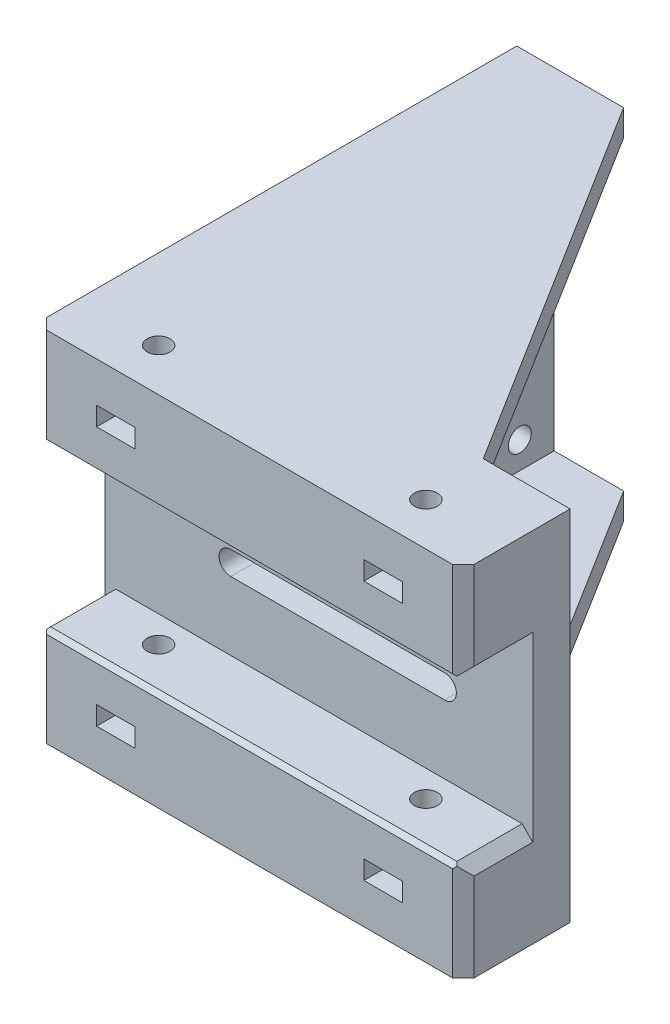
from build123d import *

# Parameters (mm, degrees)
BOSS_EXTRUDE1_DEPTH = 67
SKETCH2_R           = 2.15
SKETCH2_R_2         = 19.1
CUT_EXTRUDE1_DEPTH  = 67
SKETCH3_W           = 70
SKETCH3_H           = 4.9
BOSS_EXTRUDE2_DEPTH = 63
SKETCH4_W           = 20
SKETCH4_H           = 67
BOSS_EXTRUDE3_DEPTH = 10
CHAMFER1_SIZE       = 80
CHAMFER1_SIZE_2     = 50
SKETCH6_W           = 80
SKETCH6_H           = 30
CUT_EXTRUDE2_DEPTH  = 13
SKETCH7_R           = 2.15
CUT_EXTRUDE3_DEPTH  = 100
CUT_EXTRUDE4_DEPTH  = 100
FILLET2_R           = 8
SKETCH9_W           = 7.2
SKETCH9_H           = 3.5
CUT_EXTRUDE5_DEPTH  = 14
CHAMFER2_SIZE       = 2
CHAMFER3_SIZE       = 2
CHAMFER4_SIZE       = 0.8
CHAMFER5_SIZE       = 3


with BuildPart() as part:
    # Sketch1 → Boss-Extrude1 (new body)
    with BuildSketch(Plane(origin=(0, 0, 0), x_dir=(1, 0, 0), z_dir=(0, 1, 0))):
        Polygon((0, 0), (0, 90), (7, 90), (7, 20), (70, 20), (70, 0), align=None)
    extrude(amount=BOSS_EXTRUDE1_DEPTH)

    # Sketch2 → Cut-Extrude1 (cut)
    with BuildSketch(Plane(origin=(7, 0, 0), x_dir=(0, 0, -1), z_dir=(1, 0, 0))):
        with Locations((83.57, 57.07)):
            Circle(SKETCH2_R)
        with Locations((36.43, 57.07)):
            Circle(SKETCH2_R)
        with Locations((36.43, 9.93)):
            Circle(SKETCH2_R)
        with Locations((83.57, 9.93)):
            Circle(SKETCH2_R)
        with Locations((60, 33.5)):
            Circle(SKETCH2_R_2)
    extrude(amount=-CUT_EXTRUDE1_DEPTH, mode=Mode.SUBTRACT)

    # Sketch3 → Boss-Extrude2 (add)
    with BuildSketch(Plane(origin=(7, 0, 0), x_dir=(0, 0, -1), z_dir=(1, 0, 0))):
        with Locations((55, 64.55)):
            Rectangle(SKETCH3_W, SKETCH3_H)
        with Locations((55, 2.45)):
            Rectangle(SKETCH3_W, SKETCH3_H)
    extrude(amount=BOSS_EXTRUDE2_DEPTH)

    # Sketch4 → Boss-Extrude3 (add)
    with BuildSketch(Plane(origin=(70, 0, 0), x_dir=(0, 0, -1), z_dir=(1, 0, 0))):
        with Locations((10, 33.5)):
            Rectangle(SKETCH4_W, SKETCH4_H)
    extrude(amount=BOSS_EXTRUDE3_DEPTH)

    # Chamfer1
    # the kernel refuses this chamfer: 80, 50 mm, written as the material it takes off along each edge
    with BuildSketch(Plane(origin=(70, -206.827451207, -90), x_dir=(0.020500139102813345, 0, 0.9997898500668855), z_dir=(0, 1, 0))) as chamfer1_piece_1_section:
        Polygon((CHAMFER1_SIZE * 0.999789850067, -CHAMFER1_SIZE * 0.0205001391028), (-CHAMFER1_SIZE_2 * 0.0205001391028, -CHAMFER1_SIZE_2 * 0.999789850067), (0, 0), align=None)
    chamfer1_piece_1 = extrude(amount=418.554902414, mode=Mode.PRIVATE)
    chamfer1_piece_1 = split(chamfer1_piece_1, bisect_by=Plane(origin=(53.400446445, 2.45, -20), z_dir=(0, 0, -1)), keep=Keep.TOP, mode=Mode.PRIVATE)
    add(chamfer1_piece_1, mode=Mode.SUBTRACT)
    with BuildSketch(Plane(origin=(70, 273.827451207, -90), x_dir=(0.020500139102813345, 0, 0.9997898500668855), z_dir=(0, -1, 0))) as chamfer1_piece_2_section:
        Polygon((CHAMFER1_SIZE * 0.999789850067, CHAMFER1_SIZE * 0.0205001391028), (-CHAMFER1_SIZE_2 * 0.0205001391028, CHAMFER1_SIZE_2 * 0.999789850067), (0, 0), align=None)
    chamfer1_piece_2 = extrude(amount=418.554902414, mode=Mode.PRIVATE)
    chamfer1_piece_2 = split(chamfer1_piece_2, bisect_by=Plane(origin=(53.400446445, 64.55, -20), z_dir=(0, 0, -1)), keep=Keep.TOP, mode=Mode.PRIVATE)
    add(chamfer1_piece_2, mode=Mode.SUBTRACT)

    # Sketch6 → Cut-Extrude2 (cut)
    with BuildSketch(Plane.XY):
        with Locations((40, 33.5)):
            Rectangle(SKETCH6_W, SKETCH6_H)
    extrude(amount=-CUT_EXTRUDE2_DEPTH, mode=Mode.SUBTRACT)

    # Sketch7 → Cut-Extrude3 (cut)
    with BuildSketch(Plane(origin=(0, 67, 0), x_dir=(1, 0, 0), z_dir=(0, 1, 0))):
        with Locations(Location((15, 8, 0), (0, 0, 270))):
            Circle(SKETCH7_R)
        with Locations(Location((65, 8, 0), (0, 0, 270))):
            Circle(SKETCH7_R)
    extrude(amount=-CUT_EXTRUDE3_DEPTH, mode=Mode.SUBTRACT)

    # Sketch8 → Cut-Extrude4 (cut)
    with BuildSketch(Plane(origin=(0, 0, -20), x_dir=(-1, 0, 0), z_dir=(0, 0, -1))):
        with BuildLine():
            Line((-63.5, 35.7), (-23.5, 35.7))
            ThreePointArc((-23.5, 35.7), (-21.3, 33.5), (-23.5, 31.3))
            Line((-23.5, 31.3), (-63.5, 31.3))
            ThreePointArc((-63.5, 31.3), (-65.7, 33.5), (-63.5, 35.7))
        make_face()
    extrude(amount=-CUT_EXTRUDE4_DEPTH, mode=Mode.SUBTRACT)

    # Fillet2
    fillet2_edges = [part.edges().sort_by_distance(p)[0] for p in [
        (7, 33.5, -20),
    ]]
    fillet(fillet2_edges, radius=FILLET2_R)

    # Sketch9 → Cut-Extrude5 (cut)
    with BuildSketch(Plane.XY):
        with Locations((65, 57.75)):
            Rectangle(SKETCH9_W, SKETCH9_H)
        with Locations((15, 57.75)):
            Rectangle(SKETCH9_W, SKETCH9_H)
        with Locations((65, 9.25)):
            Rectangle(SKETCH9_W, SKETCH9_H)
        with Locations((15, 9.25)):
            Rectangle(SKETCH9_W, SKETCH9_H)
    extrude(amount=-CUT_EXTRUDE5_DEPTH, mode=Mode.SUBTRACT)

    # Chamfer2
    chamfer2_edges = [part.edges().sort_by_distance(p)[0] for p in [
        (80, 48.5, -6.5),
        (80, 18.5, -6.5),
        (0, 18.5, -6.5),
        (0, 48.5, -6.5),
    ]]
    chamfer(chamfer2_edges, length=CHAMFER2_SIZE)

    # Chamfer3
    chamfer3_edges = [part.edges().sort_by_distance(p)[0] for p in [
        (80, 58.75, 0),
        (80, 8.25, 0),
        (0, 58.75, 0),
        (0, 8.25, 0),
    ]]
    chamfer(chamfer3_edges, length=CHAMFER3_SIZE)

    # Chamfer4
    chamfer4_edges = [part.edges().sort_by_distance(p)[0] for p in [
        (40, 18.5, 0),
        (40, 48.5, 0),
    ]]
    chamfer(chamfer4_edges, length=CHAMFER4_SIZE)

    # Chamfer5
    chamfer5_edges = [part.edges().sort_by_distance(p)[0] for p in [
        (0, 33.5, -40.9),
    ]]
    chamfer(chamfer5_edges, length=CHAMFER5_SIZE)


solid = part.part
